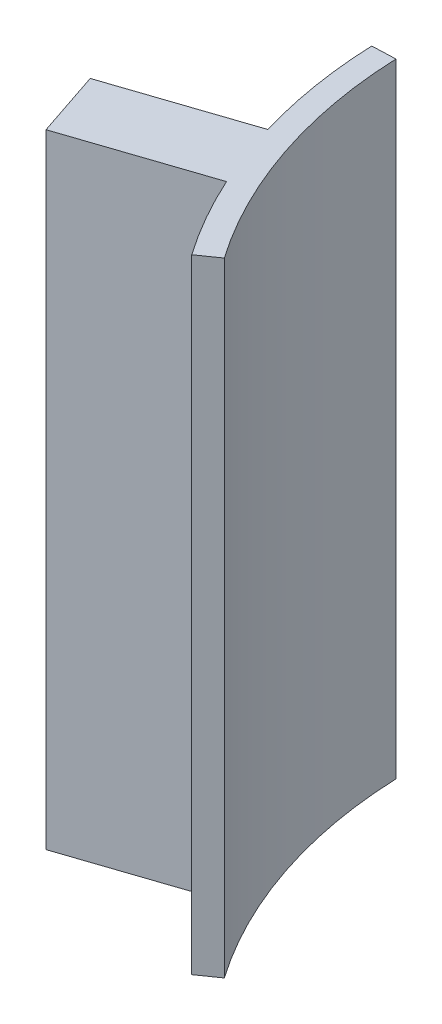
from build123d import *

# Parameters (mm, degrees)
BOSS_EXTRUDE1_DEPTH = 80


with BuildPart() as part:
    # Sketch1 → Boss-Extrude1 (new body)
    with BuildSketch(Plane(origin=(0, 0, 0), x_dir=(1, 0, 0), z_dir=(0, 1, 0))):
        with BuildLine():
            ThreePointArc((-50.847545831, -35.475725264), (-58.784718857, -19.706771143), (-61.955824005, -2.340058101))
            Line((-61.955824005, -2.340058101), (-64.953686456, -2.453286719))
            ThreePointArc((-64.953686456, -2.453286719), (-64.145431221, -10.505410678), (-62.342884198, -18.394694613))
            Line((-62.342884198, -18.394694613), (-79.409415479, -24.116015267))
            Line((-79.409415479, -24.116015267), (-76.548755152, -32.649280907))
            Line((-76.548755152, -32.649280907), (-59.202429764, -26.834163114))
            ThreePointArc((-59.202429764, -26.834163114), (-56.493069519, -32.148609555), (-53.307910951, -37.192292615))
            Line((-53.307910951, -37.192292615), (-50.847545831, -35.475725264))
        make_face()
    extrude(amount=BOSS_EXTRUDE1_DEPTH)


solid = part.part
